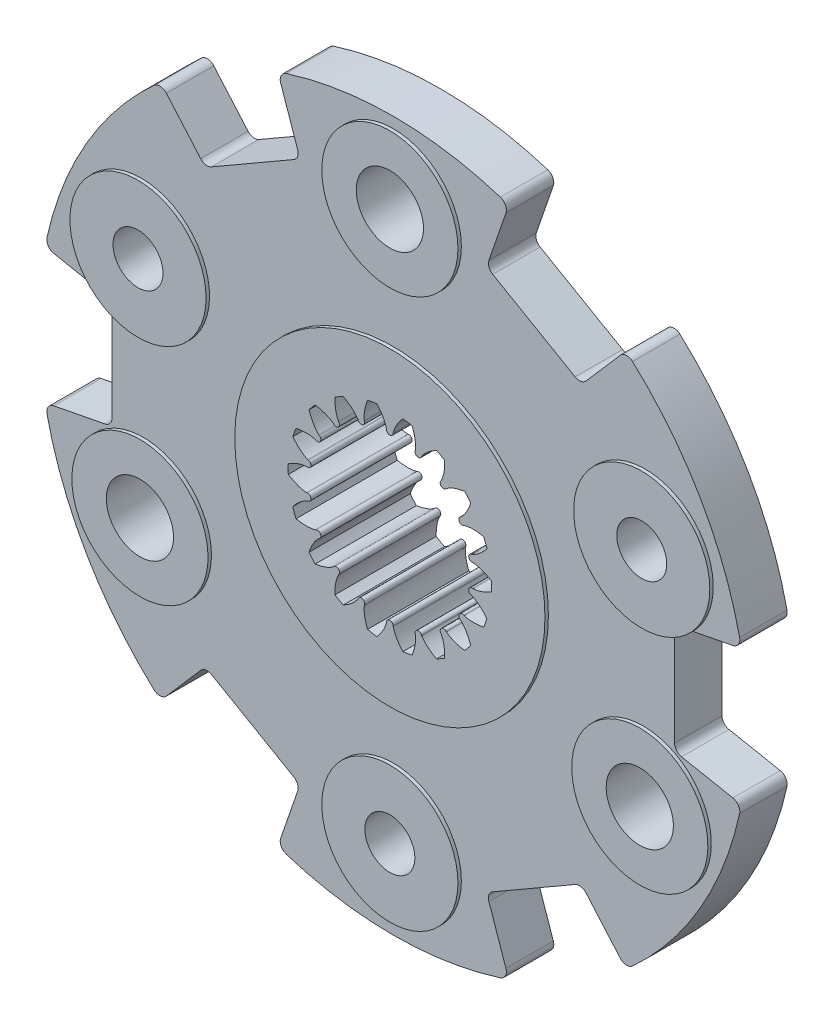
from build123d import *

# Parameters (mm, degrees)
SKETCH1_R                                 = 10.4521
BASE_DISK_DEPTH                           = 1.397
SKETCH2_R                                 = 2.0066
PLATFORM_1_DEPTH                          = 0.1016
SKETCH3_R                                 = 0.9906
HOLE_1_DEPTH                              = 15.857274002
SKETCH7_R                                 = 2.0066
PLATFORM_2_DEPTH                          = 0.1016
SKETCH8_R                                 = 0.7366
HOLE_2_DEPTH                              = 15.857274002
NEGATIVE_PATTERN_OF_PLATFORM_HOLE_1_COUNT = 2
NEGATIVE_PATTERN_OF_PLATFORM_HOLE_1_ANGLE = 115
POSITIVE_PATTERN_OF_PLATFORM_HOLE_1_COUNT = 2
POSITIVE_PATTERN_OF_PLATFORM_HOLE_1_ANGLE = 115
NEGATIVE_PATTERN_OF_PLATFORM_HOLE_2_COUNT = 2
NEGATIVE_PATTERN_OF_PLATFORM_HOLE_2_ANGLE = 113
POSITIVE_PATTERN_OF_PLATFORM_HOLE_2_COUNT = 2
POSITIVE_PATTERN_OF_PLATFORM_HOLE_2_ANGLE = 113
RECTANGULAR_CUT_OUT_DEPTH                 = 15.847370064
PATTERN_FOR_RECTANGULAR_CUT_OUT_COUNT     = 6
EDGE_FILLETS_R                            = 0.254
HUB_DEPTH                                 = 1.4859
HUB_DEPTH_BACK                            = 1.4986
SKETCH5_R                                 = 4.572
HUB_CHAMFER_SIZE                          = 0.381
SPLINE_START                              = -1.4859
SPLINE_CUT_OUT_DEPTH                      = 2.9845
TOLERANCE_CUT_OUT_DEPTH                   = 15.915170021


# Read off the part's stored shape, not the designer's step: Spline cut-out
with BuildPart() as part:
    # Sketch1 → Base disk (new body)
    with BuildSketch(Plane.XY):
        Circle(SKETCH1_R)
    extrude(amount=BASE_DISK_DEPTH)

    # Sketch2 → Platform 1 (add)
    with BuildSketch(Plane.XY.offset(1.397)):
        with Locations((0, 8.128)):
            Circle(SKETCH2_R)
    platform_1 = extrude(amount=PLATFORM_1_DEPTH)

    # Sketch3 → Hole 1 (cut, through all)
    with BuildSketch(Plane.XY.offset(1.4986)):
        with Locations((0, 8.128)):
            Circle(SKETCH3_R)
    hole_1 = extrude(amount=-HOLE_1_DEPTH, mode=Mode.SUBTRACT)

    # Sketch7 → Platform 2 (add)
    with BuildSketch(Plane.XY.offset(1.397)):
        with Locations((0, -8.0645)):
            Circle(SKETCH7_R)
    platform_2 = extrude(amount=PLATFORM_2_DEPTH)

    # Sketch8 → Hole 2 (cut, through all)
    with BuildSketch(Plane.XY.offset(1.4986)):
        with Locations((0, -8.0645)):
            Circle(SKETCH8_R)
    hole_2 = extrude(amount=-HOLE_2_DEPTH, mode=Mode.SUBTRACT)

    # Negative pattern of platform/hole 1: Platform 1, Hole 1 ×2 about axis
    negative_pattern_of_platform_hole_1_axis = Axis((0, 0, 1.397), (0, 0, 1))
    add([platform_1.rotate(negative_pattern_of_platform_hole_1_axis, i * NEGATIVE_PATTERN_OF_PLATFORM_HOLE_1_ANGLE / (NEGATIVE_PATTERN_OF_PLATFORM_HOLE_1_COUNT - 1)) for i in range(1, NEGATIVE_PATTERN_OF_PLATFORM_HOLE_1_COUNT)])
    add([hole_1.rotate(negative_pattern_of_platform_hole_1_axis, i * NEGATIVE_PATTERN_OF_PLATFORM_HOLE_1_ANGLE / (NEGATIVE_PATTERN_OF_PLATFORM_HOLE_1_COUNT - 1)) for i in range(1, NEGATIVE_PATTERN_OF_PLATFORM_HOLE_1_COUNT)], mode=Mode.SUBTRACT)

    # Positive pattern of platform/hole 1: Platform 1, Hole 1 ×2 about axis
    positive_pattern_of_platform_hole_1_axis = Axis((0, 0, 1.397), (0, 0, -1))
    add([platform_1.rotate(positive_pattern_of_platform_hole_1_axis, i * POSITIVE_PATTERN_OF_PLATFORM_HOLE_1_ANGLE / (POSITIVE_PATTERN_OF_PLATFORM_HOLE_1_COUNT - 1)) for i in range(1, POSITIVE_PATTERN_OF_PLATFORM_HOLE_1_COUNT)])
    add([hole_1.rotate(positive_pattern_of_platform_hole_1_axis, i * POSITIVE_PATTERN_OF_PLATFORM_HOLE_1_ANGLE / (POSITIVE_PATTERN_OF_PLATFORM_HOLE_1_COUNT - 1)) for i in range(1, POSITIVE_PATTERN_OF_PLATFORM_HOLE_1_COUNT)], mode=Mode.SUBTRACT)

    # Negative pattern of platform/hole 2: Platform 2, Hole 2 ×2 about axis
    negative_pattern_of_platform_hole_2_axis = Axis((0, 0, 1.397), (0, 0, 1))
    add([platform_2.rotate(negative_pattern_of_platform_hole_2_axis, i * NEGATIVE_PATTERN_OF_PLATFORM_HOLE_2_ANGLE / (NEGATIVE_PATTERN_OF_PLATFORM_HOLE_2_COUNT - 1)) for i in range(1, NEGATIVE_PATTERN_OF_PLATFORM_HOLE_2_COUNT)])
    add([hole_2.rotate(negative_pattern_of_platform_hole_2_axis, i * NEGATIVE_PATTERN_OF_PLATFORM_HOLE_2_ANGLE / (NEGATIVE_PATTERN_OF_PLATFORM_HOLE_2_COUNT - 1)) for i in range(1, NEGATIVE_PATTERN_OF_PLATFORM_HOLE_2_COUNT)], mode=Mode.SUBTRACT)

    # Positive pattern of platform/hole 2: Platform 2, Hole 2 ×2 about axis
    positive_pattern_of_platform_hole_2_axis = Axis((0, 0, 1.397), (0, 0, -1))
    add([platform_2.rotate(positive_pattern_of_platform_hole_2_axis, i * POSITIVE_PATTERN_OF_PLATFORM_HOLE_2_ANGLE / (POSITIVE_PATTERN_OF_PLATFORM_HOLE_2_COUNT - 1)) for i in range(1, POSITIVE_PATTERN_OF_PLATFORM_HOLE_2_COUNT)])
    add([hole_2.rotate(positive_pattern_of_platform_hole_2_axis, i * POSITIVE_PATTERN_OF_PLATFORM_HOLE_2_ANGLE / (POSITIVE_PATTERN_OF_PLATFORM_HOLE_2_COUNT - 1)) for i in range(1, POSITIVE_PATTERN_OF_PLATFORM_HOLE_2_COUNT)], mode=Mode.SUBTRACT)

    # Sketch4 → Rectangular cut-out (cut, through all)
    with BuildSketch(Plane.XY.offset(1.397)):
        with BuildLine():
            Line((-5.540746529, 6.37389976), (-6.857194577, 7.888300003))
            ThreePointArc((-6.857194577, 7.888300003), (-5.22605, 9.051784123), (-3.402870907, 9.882654704))
            Line((-3.402870907, 9.882654704), (-2.749585848, 7.98537713))
            Line((-2.749585848, 7.98537713), (-5.540746529, 6.37389976))
        make_face()
    rectangular_cut_out = extrude(amount=-RECTANGULAR_CUT_OUT_DEPTH, mode=Mode.SUBTRACT)

    # Pattern for rectangular cut-out: Rectangular cut-out ×6 about axis
    pattern_for_rectangular_cut_out_axis = Axis((0, 0, 0), (0, 0, 1))
    for i in range(1, PATTERN_FOR_RECTANGULAR_CUT_OUT_COUNT):
        add(rectangular_cut_out.rotate(pattern_for_rectangular_cut_out_axis, i * 360 / PATTERN_FOR_RECTANGULAR_CUT_OUT_COUNT), mode=Mode.SUBTRACT)

    # Edge fillets
    edge_fillets_edges = [part.edges().sort_by_distance(p)[0] for p in [
        (6.857194577, -7.888300003, 0.6985),
        (3.402870907, -9.882654704, 0.6985),
        (2.749585848, -7.98537713, 0.6985),
        (5.540746529, -6.37389976, 0.6985),
        (10.260065484, 1.994354701, 0.6985),
        (10.260065484, -1.994354701, 0.6985),
        (8.290332378, -1.61147737, 0.6985),
        (8.290332378, 1.61147737, 0.6985),
        (3.402870907, 9.882654704, 0.6985),
        (6.857194577, 7.888300003, 0.6985),
        (5.540746529, 6.37389976, 0.6985),
        (2.749585848, 7.98537713, 0.6985),
        (-6.857194577, 7.888300003, 0.6985),
        (-3.402870907, 9.882654704, 0.6985),
        (-2.749585848, 7.98537713, 0.6985),
        (-5.540746529, 6.37389976, 0.6985),
        (-10.260065484, -1.994354701, 0.6985),
        (-10.260065484, 1.994354701, 0.6985),
        (-8.290332378, 1.61147737, 0.6985),
        (-8.290332378, -1.61147737, 0.6985),
        (-3.402870907, -9.882654704, 0.6985),
        (-6.857194577, -7.888300003, 0.6985),
        (-5.540746529, -6.37389976, 0.6985),
        (-2.749585848, -7.98537713, 0.6985),
    ]]
    fillet(edge_fillets_edges, radius=EDGE_FILLETS_R)

    # Sketch5 → Hub (add, two sides: drawn at the far end of the back side and taken through both)
    with BuildSketch(Plane(origin=(0, 0, 0), x_dir=(-1, 0, 0), z_dir=(0, 0, -1)).offset(-HUB_DEPTH_BACK)):
        Circle(SKETCH5_R)
    extrude(amount=HUB_DEPTH + HUB_DEPTH_BACK)

    # Hub chamfer
    hub_chamfer_edges = [part.edges().sort_by_distance(p)[0] for p in [
        (4.572, 0, -1.4859),
    ]]
    chamfer(hub_chamfer_edges, length=HUB_CHAMFER_SIZE)

    # Spline cut-out outline → Spline cut-out (cut)
    with BuildSketch(Plane.XY.offset(SPLINE_START)):
        with BuildLine():
            Line((-2.441544292, 0.253382626), (-2.457161288, 0.255003353))
            add(Edge.make_bspline(
                [(-2.457161288, 0.255003353), (-2.511970923, 0.25245669), (-2.674677864, 0.22493294), (-2.825486334, 0.152013752), (-2.91943351, 0.095650308)],
                knots=[0, 0, 0, 0, 0.332628043, 1, 1, 1, 1], degree=3))
            ThreePointArc((-2.91943351, 0.095650308), (-2.921, 0), (-2.91943351, -0.095650308))
            add(Edge.make_bspline(
                [(-2.457161288, -0.255003353), (-2.511970923, -0.25245669), (-2.674677864, -0.22493294), (-2.825486334, -0.152013752), (-2.91943351, -0.095650308)],
                knots=[0, 0, 0, 0, 0.332628043, 1, 1, 1, 1], degree=3))
            Line((-2.457161288, -0.255003353), (-2.441544292, -0.253382626))
            ThreePointArc((-2.441544292, -0.253382626), (-2.251270523, -0.396959734), (-2.380963117, -0.596955545))
            Line((-2.380963117, -0.596955545), (-2.396192614, -0.600773887))
            add(Edge.make_bspline(
                [(-2.396192614, -0.600773887), (-2.446825813, -0.621912967), (-2.590306648, -0.703425883), (-2.707080423, -0.82352704), (-2.776084458, -0.908623179)],
                knots=[0, 0, 0, 0, 0.332628043, 1, 1, 1, 1], degree=3))
            ThreePointArc((-2.776084458, -0.908623179), (-2.744842145, -0.999040839), (-2.710655794, -1.088386956))
            add(Edge.make_bspline(
                [(-2.221760047, -1.080023425), (-2.274135267, -1.096376344), (-2.436443455, -1.12616153), (-2.603096893, -1.109219442), (-2.710655794, -1.088386956)],
                knots=[0, 0, 0, 0, 0.332628043, 1, 1, 1, 1], degree=3))
            Line((-2.221760047, -1.080023425), (-2.207639193, -1.073159113))
            ThreePointArc((-2.207639193, -1.073159113), (-1.979734073, -1.143), (-2.03320265, -1.375292067))
            Line((-2.03320265, -1.375292067), (-2.046207746, -1.38408893))
            add(Edge.make_bspline(
                [(-2.046207746, -1.38408893), (-2.086557399, -1.421270741), (-2.193506221, -1.546941162), (-2.262160662, -1.699738317), (-2.29789865, -1.803303301)],
                knots=[0, 0, 0, 0, 0.332628043, 1, 1, 1, 1], degree=3))
            ThreePointArc((-2.29789865, -1.803303301), (-2.237615818, -1.877582608), (-2.174932985, -1.949848074))
            add(Edge.make_bspline(
                [(-1.718381755, -1.774776732), (-1.762005335, -1.80805683), (-1.904338008, -1.891558419), (-2.066735549, -1.932636897), (-2.174932985, -1.949848074)],
                knots=[0, 0, 0, 0, 0.332628043, 1, 1, 1, 1], degree=3))
            Line((-1.718381755, -1.774776732), (-1.707460225, -1.763496773))
            ThreePointArc((-1.707460225, -1.763496773), (-1.469412476, -1.751177597), (-1.440207937, -1.987748068))
            Line((-1.440207937, -1.987748068), (-1.449420026, -2.00046242))
            add(Edge.make_bspline(
                [(-1.449420026, -2.00046242), (-1.474619368, -2.049202288), (-1.532136572, -2.203872507), (-1.544390938, -2.370936067), (-1.542552351, -2.48047843)],
                knots=[0, 0, 0, 0, 0.332628043, 1, 1, 1, 1], degree=3))
            ThreePointArc((-1.542552351, -2.48047843), (-1.4605, -2.529660204), (-1.376881159, -2.576128738))
            add(Edge.make_bspline(
                [(-1.007741262, -2.255465773), (-1.037351555, -2.301658978), (-1.142541292, -2.428805447), (-1.281095396, -2.522949819), (-1.376881159, -2.576128738)],
                knots=[0, 0, 0, 0, 0.332628043, 1, 1, 1, 1], degree=3))
            Line((-1.007741262, -2.255465773), (-1.001336355, -2.241130695))
            ThreePointArc((-1.001336355, -2.241130695), (-0.781858048, -2.148137331), (-0.673502892, -2.360452317))
            Line((-0.673502892, -2.360452317), (-0.677810859, -2.375550619))
            add(Edge.make_bspline(
                [(-0.677810859, -2.375550619), (-0.684820479, -2.429969796), (-0.68596864, -2.594984302), (-0.640344874, -2.756163937), (-0.601151473, -2.858471253)],
                knots=[0, 0, 0, 0, 0.332628043, 1, 1, 1, 1], degree=3))
            ThreePointArc((-0.601151473, -2.858471253), (-0.507226327, -2.876623447), (-0.412757144, -2.891690257))
            add(Edge.make_bspline(
                [(-0.175552301, -2.464112355), (-0.187577868, -2.517647084), (-0.242937234, -2.673102692), (-0.340936231, -2.808957759), (-0.412757144, -2.891690257)],
                knots=[0, 0, 0, 0, 0.332628043, 1, 1, 1, 1], degree=3))
            Line((-0.175552301, -2.464112355), (-0.174436542, -2.44845118))
            ThreePointArc((-0.174436542, -2.44845118), (0, -2.286), (0.174436542, -2.44845118))
            Line((0.174436542, -2.44845118), (0.175552301, -2.464112355))
            add(Edge.make_bspline(
                [(0.175552301, -2.464112355), (0.187577868, -2.517647084), (0.242937234, -2.673102692), (0.340936231, -2.808957759), (0.412757144, -2.891690257)],
                knots=[0, 0, 0, 0, 0.332628043, 1, 1, 1, 1], degree=3))
            ThreePointArc((0.412757144, -2.891690257), (0.507226327, -2.876623447), (0.601151473, -2.858471253))
            add(Edge.make_bspline(
                [(0.677810859, -2.375550619), (0.684820479, -2.429969796), (0.68596864, -2.594984302), (0.640344874, -2.756163937), (0.601151473, -2.858471253)],
                knots=[0, 0, 0, 0, 0.332628043, 1, 1, 1, 1], degree=3))
            Line((0.677810859, -2.375550619), (0.673502892, -2.360452317))
            ThreePointArc((0.673502892, -2.360452317), (0.781858048, -2.148137331), (1.001336355, -2.241130695))
            Line((1.001336355, -2.241130695), (1.007741262, -2.255465773))
            add(Edge.make_bspline(
                [(1.007741262, -2.255465773), (1.037351555, -2.301658978), (1.142541292, -2.428805447), (1.281095396, -2.522949819), (1.376881159, -2.576128738)],
                knots=[0, 0, 0, 0, 0.332628043, 1, 1, 1, 1], degree=3))
            ThreePointArc((1.376881159, -2.576128738), (1.4605, -2.529660204), (1.542552351, -2.48047843))
            add(Edge.make_bspline(
                [(1.449420026, -2.00046242), (1.474619368, -2.049202288), (1.532136572, -2.203872507), (1.544390938, -2.370936067), (1.542552351, -2.48047843)],
                knots=[0, 0, 0, 0, 0.332628043, 1, 1, 1, 1], degree=3))
            Line((1.449420026, -2.00046242), (1.440207937, -1.987748068))
            ThreePointArc((1.440207937, -1.987748068), (1.469412476, -1.751177597), (1.707460225, -1.763496773))
            Line((1.707460225, -1.763496773), (1.718381755, -1.774776732))
            add(Edge.make_bspline(
                [(1.718381755, -1.774776732), (1.762005335, -1.80805683), (1.904338008, -1.891558419), (2.066735549, -1.932636897), (2.174932985, -1.949848074)],
                knots=[0, 0, 0, 0, 0.332628043, 1, 1, 1, 1], degree=3))
            ThreePointArc((2.174932985, -1.949848074), (2.237615818, -1.877582608), (2.29789865, -1.803303301))
            add(Edge.make_bspline(
                [(2.046207746, -1.38408893), (2.086557399, -1.421270741), (2.193506221, -1.546941162), (2.262160662, -1.699738317), (2.29789865, -1.803303301)],
                knots=[0, 0, 0, 0, 0.332628043, 1, 1, 1, 1], degree=3))
            Line((2.046207746, -1.38408893), (2.03320265, -1.375292067))
            ThreePointArc((2.03320265, -1.375292067), (1.979734073, -1.143), (2.207639193, -1.073159113))
            Line((2.207639193, -1.073159113), (2.221760047, -1.080023425))
            add(Edge.make_bspline(
                [(2.221760047, -1.080023425), (2.274135267, -1.096376344), (2.436443455, -1.12616153), (2.603096893, -1.109219442), (2.710655794, -1.088386956)],
                knots=[0, 0, 0, 0, 0.332628043, 1, 1, 1, 1], degree=3))
            ThreePointArc((2.710655794, -1.088386956), (2.744842145, -0.999040839), (2.776084458, -0.908623179))
            add(Edge.make_bspline(
                [(2.396192614, -0.600773887), (2.446825813, -0.621912967), (2.590306648, -0.703425883), (2.707080423, -0.82352704), (2.776084458, -0.908623179)],
                knots=[0, 0, 0, 0, 0.332628043, 1, 1, 1, 1], degree=3))
            Line((2.396192614, -0.600773887), (2.380963117, -0.596955545))
            ThreePointArc((2.380963117, -0.596955545), (2.251270523, -0.396959734), (2.441544292, -0.253382626))
            Line((2.441544292, -0.253382626), (2.457161288, -0.255003353))
            add(Edge.make_bspline(
                [(2.457161288, -0.255003353), (2.511970923, -0.25245669), (2.674677864, -0.22493294), (2.825486334, -0.152013752), (2.91943351, -0.095650308)],
                knots=[0, 0, 0, 0, 0.332628043, 1, 1, 1, 1], degree=3))
            ThreePointArc((2.91943351, -0.095650308), (2.921, 0), (2.91943351, 0.095650308))
            add(Edge.make_bspline(
                [(2.457161288, 0.255003353), (2.511970923, 0.25245669), (2.674677864, 0.22493294), (2.825486334, 0.152013752), (2.91943351, 0.095650308)],
                knots=[0, 0, 0, 0, 0.332628043, 1, 1, 1, 1], degree=3))
            Line((2.457161288, 0.255003353), (2.441544292, 0.253382626))
            ThreePointArc((2.441544292, 0.253382626), (2.251270523, 0.396959734), (2.380963117, 0.596955545))
            Line((2.380963117, 0.596955545), (2.396192614, 0.600773887))
            add(Edge.make_bspline(
                [(2.396192614, 0.600773887), (2.446825813, 0.621912967), (2.590306648, 0.703425883), (2.707080423, 0.82352704), (2.776084458, 0.908623179)],
                knots=[0, 0, 0, 0, 0.332628043, 1, 1, 1, 1], degree=3))
            ThreePointArc((2.776084458, 0.908623179), (2.744842145, 0.999040839), (2.710655794, 1.088386956))
            add(Edge.make_bspline(
                [(2.221760047, 1.080023425), (2.274135267, 1.096376344), (2.436443455, 1.12616153), (2.603096893, 1.109219442), (2.710655794, 1.088386956)],
                knots=[0, 0, 0, 0, 0.332628043, 1, 1, 1, 1], degree=3))
            Line((2.221760047, 1.080023425), (2.207639193, 1.073159113))
            ThreePointArc((2.207639193, 1.073159113), (1.979734073, 1.143), (2.03320265, 1.375292067))
            Line((2.03320265, 1.375292067), (2.046207746, 1.38408893))
            add(Edge.make_bspline(
                [(2.046207746, 1.38408893), (2.086557399, 1.421270741), (2.193506221, 1.546941162), (2.262160662, 1.699738317), (2.29789865, 1.803303301)],
                knots=[0, 0, 0, 0, 0.332628043, 1, 1, 1, 1], degree=3))
            ThreePointArc((2.29789865, 1.803303301), (2.237615818, 1.877582608), (2.174932985, 1.949848074))
            add(Edge.make_bspline(
                [(1.718381755, 1.774776732), (1.762005335, 1.80805683), (1.904338008, 1.891558419), (2.066735549, 1.932636897), (2.174932985, 1.949848074)],
                knots=[0, 0, 0, 0, 0.332628043, 1, 1, 1, 1], degree=3))
            Line((1.718381755, 1.774776732), (1.707460225, 1.763496773))
            ThreePointArc((1.707460225, 1.763496773), (1.469412476, 1.751177597), (1.440207937, 1.987748068))
            Line((1.440207937, 1.987748068), (1.449420026, 2.00046242))
            add(Edge.make_bspline(
                [(1.449420026, 2.00046242), (1.474619368, 2.049202288), (1.532136572, 2.203872507), (1.544390938, 2.370936067), (1.542552351, 2.48047843)],
                knots=[0, 0, 0, 0, 0.332628043, 1, 1, 1, 1], degree=3))
            ThreePointArc((1.542552351, 2.48047843), (1.4605, 2.529660204), (1.376881159, 2.576128738))
            add(Edge.make_bspline(
                [(1.007741262, 2.255465773), (1.037351555, 2.301658978), (1.142541292, 2.428805447), (1.281095396, 2.522949819), (1.376881159, 2.576128738)],
                knots=[0, 0, 0, 0, 0.332628043, 1, 1, 1, 1], degree=3))
            Line((1.007741262, 2.255465773), (1.001336355, 2.241130695))
            ThreePointArc((1.001336355, 2.241130695), (0.781858048, 2.148137331), (0.673502892, 2.360452317))
            Line((0.673502892, 2.360452317), (0.677810859, 2.375550619))
            add(Edge.make_bspline(
                [(0.677810859, 2.375550619), (0.684820479, 2.429969796), (0.68596864, 2.594984302), (0.640344874, 2.756163937), (0.601151473, 2.858471253)],
                knots=[0, 0, 0, 0, 0.332628043, 1, 1, 1, 1], degree=3))
            ThreePointArc((0.601151473, 2.858471253), (0.507226327, 2.876623447), (0.412757144, 2.891690257))
            add(Edge.make_bspline(
                [(0.175552301, 2.464112355), (0.187577868, 2.517647084), (0.242937234, 2.673102692), (0.340936231, 2.808957759), (0.412757144, 2.891690257)],
                knots=[0, 0, 0, 0, 0.332628043, 1, 1, 1, 1], degree=3))
            Line((0.175552301, 2.464112355), (0.174436542, 2.44845118))
            ThreePointArc((0.174436542, 2.44845118), (0, 2.286), (-0.174436542, 2.44845118))
            Line((-0.174436542, 2.44845118), (-0.175552301, 2.464112355))
            add(Edge.make_bspline(
                [(-0.175552301, 2.464112355), (-0.187577868, 2.517647084), (-0.242937234, 2.673102692), (-0.340936231, 2.808957759), (-0.412757144, 2.891690257)],
                knots=[0, 0, 0, 0, 0.332628043, 1, 1, 1, 1], degree=3))
            ThreePointArc((-0.412757144, 2.891690257), (-0.507226327, 2.876623447), (-0.601151473, 2.858471253))
            add(Edge.make_bspline(
                [(-0.677810859, 2.375550619), (-0.684820479, 2.429969796), (-0.68596864, 2.594984302), (-0.640344874, 2.756163937), (-0.601151473, 2.858471253)],
                knots=[0, 0, 0, 0, 0.332628043, 1, 1, 1, 1], degree=3))
            Line((-0.677810859, 2.375550619), (-0.673502892, 2.360452317))
            ThreePointArc((-0.673502892, 2.360452317), (-0.781858048, 2.148137331), (-1.001336355, 2.241130695))
            Line((-1.001336355, 2.241130695), (-1.007741262, 2.255465773))
            add(Edge.make_bspline(
                [(-1.007741262, 2.255465773), (-1.037351555, 2.301658978), (-1.142541292, 2.428805447), (-1.281095396, 2.522949819), (-1.376881159, 2.576128738)],
                knots=[0, 0, 0, 0, 0.332628043, 1, 1, 1, 1], degree=3))
            ThreePointArc((-1.376881159, 2.576128738), (-1.4605, 2.529660204), (-1.542552351, 2.48047843))
            add(Edge.make_bspline(
                [(-1.449420026, 2.00046242), (-1.474619368, 2.049202288), (-1.532136572, 2.203872507), (-1.544390938, 2.370936067), (-1.542552351, 2.48047843)],
                knots=[0, 0, 0, 0, 0.332628043, 1, 1, 1, 1], degree=3))
            Line((-1.449420026, 2.00046242), (-1.440207937, 1.987748068))
            ThreePointArc((-1.440207937, 1.987748068), (-1.469412476, 1.751177597), (-1.707460225, 1.763496773))
            Line((-1.707460225, 1.763496773), (-1.718381755, 1.774776732))
            add(Edge.make_bspline(
                [(-1.718381755, 1.774776732), (-1.762005335, 1.80805683), (-1.904338008, 1.891558419), (-2.066735549, 1.932636897), (-2.174932985, 1.949848074)],
                knots=[0, 0, 0, 0, 0.332628043, 1, 1, 1, 1], degree=3))
            ThreePointArc((-2.174932985, 1.949848074), (-2.237615818, 1.877582608), (-2.29789865, 1.803303301))
            add(Edge.make_bspline(
                [(-2.046207746, 1.38408893), (-2.086557399, 1.421270741), (-2.193506221, 1.546941162), (-2.262160662, 1.699738317), (-2.29789865, 1.803303301)],
                knots=[0, 0, 0, 0, 0.332628043, 1, 1, 1, 1], degree=3))
            Line((-2.046207746, 1.38408893), (-2.03320265, 1.375292067))
            ThreePointArc((-2.03320265, 1.375292067), (-1.979734073, 1.143), (-2.207639193, 1.073159113))
            Line((-2.207639193, 1.073159113), (-2.221760047, 1.080023425))
            add(Edge.make_bspline(
                [(-2.221760047, 1.080023425), (-2.274135267, 1.096376344), (-2.436443455, 1.12616153), (-2.603096893, 1.109219442), (-2.710655794, 1.088386956)],
                knots=[0, 0, 0, 0, 0.332628043, 1, 1, 1, 1], degree=3))
            ThreePointArc((-2.710655794, 1.088386956), (-2.744842145, 0.999040839), (-2.776084458, 0.908623179))
            add(Edge.make_bspline(
                [(-2.396192614, 0.600773887), (-2.446825813, 0.621912967), (-2.590306648, 0.703425883), (-2.707080423, 0.82352704), (-2.776084458, 0.908623179)],
                knots=[0, 0, 0, 0, 0.332628043, 1, 1, 1, 1], degree=3))
            Line((-2.396192614, 0.600773887), (-2.380963117, 0.596955545))
            ThreePointArc((-2.380963117, 0.596955545), (-2.251270523, 0.396959734), (-2.441544292, 0.253382626))
        make_face()
    extrude(amount=SPLINE_CUT_OUT_DEPTH, mode=Mode.SUBTRACT)

    # Sketch6 → Tolerance cut-out (cut, through all)
    with BuildSketch(Plane.XY.offset(1.4986)):
        with BuildLine():
            Line((2.420271814, -0.528252538), (2.399494428, -0.523043228))
            ThreePointArc((2.399494428, -0.523043228), (2.326312874, -0.410191725), (2.433678527, -0.329175566))
            Line((2.433678527, -0.329175566), (2.454984573, -0.3313867))
            add(Edge.make_bspline(
                [(2.454984573, -0.3313867), (2.645441737, -0.32253734), (2.830441607, -0.237902523), (2.993937206, -0.139813624)],
                knots=[-0.011557885, -0.011557885, -0.011557885, -0.011557885, 1.083590596, 1.083590596, 1.083590596, 1.083590596], degree=3))
            ThreePointArc((2.993937206, -0.139813624), (2.9972, 0), (2.993937206, 0.139813624))
            add(Edge.make_bspline(
                [(2.993937206, 0.139813624), (2.830441607, 0.237902523), (2.645441737, 0.32253734), (2.454984573, 0.3313867)],
                knots=[-0.083590596, -0.083590596, -0.083590596, -0.083590596, 1.011557885, 1.011557885, 1.011557885, 1.011557885], degree=3))
            Line((2.454984573, 0.3313867), (2.433678527, 0.329175566))
            ThreePointArc((2.433678527, 0.329175566), (2.326312874, 0.410191725), (2.399494428, 0.523043228))
            Line((2.399494428, 0.523043228), (2.420271814, 0.528252538))
            add(Edge.make_bspline(
                [(2.420271814, 0.528252538), (2.596216347, 0.601708404), (2.741112547, 0.744512799), (2.861199775, 0.892605002)],
                knots=[-0.011557885, -0.011557885, -0.011557885, -0.011557885, 1.083590596, 1.083590596, 1.083590596, 1.083590596], degree=3))
            ThreePointArc((2.861199775, 0.892605002), (2.816446723, 1.025102774), (2.765561623, 1.155368663))
            add(Edge.make_bspline(
                [(2.765561623, 1.155368663), (2.578377637, 1.191623289), (2.375587812, 1.207880321), (2.19358996, 1.151055812)],
                knots=[-0.083590596, -0.083590596, -0.083590596, -0.083590596, 1.011557885, 1.011557885, 1.011557885, 1.011557885], degree=3))
            Line((2.19358996, 1.151055812), (2.174325079, 1.141690929))
            ThreePointArc((2.174325079, 1.141690929), (2.045725209, 1.1811), (2.075895887, 1.31217529))
            Line((2.075895887, 1.31217529), (2.093638555, 1.324176725))
            add(Edge.make_bspline(
                [(2.093638555, 1.324176725), (2.233848948, 1.453379234), (2.321164859, 1.63712889), (2.383359424, 1.81736229)],
                knots=[-0.011557885, -0.011557885, -0.011557885, -0.011557885, 1.083590596, 1.083590596, 1.083590596, 1.083590596], degree=3))
            ThreePointArc((2.383359424, 1.81736229), (2.295988405, 1.926563024), (2.203618494, 2.03156919))
            add(Edge.make_bspline(
                [(2.203618494, 2.03156919), (2.015323271, 2.001616701), (1.819202936, 1.947535108), (1.667616025, 1.831890606)],
                knots=[-0.083590596, -0.083590596, -0.083590596, -0.083590596, 1.011557885, 1.011557885, 1.011557885, 1.011557885], degree=3))
            Line((1.667616025, 1.831890606), (1.652715937, 1.816501517))
            ThreePointArc((1.652715937, 1.816501517), (1.518392892, 1.809550184), (1.501913666, 1.943039646))
            Line((1.501913666, 1.943039646), (1.514481587, 1.960385656))
            add(Edge.make_bspline(
                [(1.514481587, 1.960385656), (1.602046399, 2.129751079), (1.621250432, 2.332283075), (1.618050753, 2.522918865)],
                knots=[-0.011557885, -0.011557885, -0.011557885, -0.011557885, 1.083590596, 1.083590596, 1.083590596, 1.083590596], degree=3))
            ThreePointArc((1.618050753, 2.522918865), (1.4986, 2.59565134), (1.375886453, 2.662732489))
            add(Edge.make_bspline(
                [(1.375886453, 2.662732489), (1.209191175, 2.570185597), (1.043395338, 2.452288419), (0.940502985, 2.291772356)],
                knots=[-0.083590596, -0.083590596, -0.083590596, -0.083590596, 1.011557885, 1.011557885, 1.011557885, 1.011557885], degree=3))
            Line((0.940502985, 2.291772356), (0.931764861, 2.272215212))
            ThreePointArc((0.931764861, 2.272215212), (0.807919983, 2.219741909), (0.746778491, 2.339544745))
            Line((0.746778491, 2.339544745), (0.752655789, 2.360143144))
            add(Edge.make_bspline(
                [(0.752655789, 2.360143144), (0.77701341, 2.549243512), (0.725789276, 2.7461295), (0.657581281, 2.924174191)],
                knots=[-0.011557885, -0.011557885, -0.011557885, -0.011557885, 1.083590596, 1.083590596, 1.083590596, 1.083590596], degree=3))
            ThreePointArc((0.657581281, 2.924174191), (0.520458318, 2.951665797), (0.382202199, 2.972730953))
            add(Edge.make_bspline(
                [(0.382202199, 2.972730953), (0.257212778, 2.828752179), (0.141738864, 2.661259554), (0.099951405, 2.475232537)],
                knots=[-0.083590596, -0.083590596, -0.083590596, -0.083590596, 1.011557885, 1.011557885, 1.011557885, 1.011557885], degree=3))
            Line((0.099951405, 2.475232537), (0.098429191, 2.453866219))
            ThreePointArc((0.098429191, 2.453866219), (0, 2.3622), (-0.098429191, 2.453866219))
            Line((-0.098429191, 2.453866219), (-0.099951405, 2.475232537))
            add(Edge.make_bspline(
                [(-0.099951405, 2.475232537), (-0.141738864, 2.661259554), (-0.257212778, 2.828752179), (-0.382202199, 2.972730953)],
                knots=[-0.011557885, -0.011557885, -0.011557885, -0.011557885, 1.083590596, 1.083590596, 1.083590596, 1.083590596], degree=3))
            ThreePointArc((-0.382202199, 2.972730953), (-0.520458318, 2.951665797), (-0.657581281, 2.924174191))
            add(Edge.make_bspline(
                [(-0.657581281, 2.924174191), (-0.725789276, 2.7461295), (-0.77701341, 2.549243512), (-0.752655789, 2.360143144)],
                knots=[-0.083590596, -0.083590596, -0.083590596, -0.083590596, 1.011557885, 1.011557885, 1.011557885, 1.011557885], degree=3))
            Line((-0.752655789, 2.360143144), (-0.746778491, 2.339544745))
            ThreePointArc((-0.746778491, 2.339544745), (-0.807919983, 2.219741909), (-0.931764861, 2.272215212))
            Line((-0.931764861, 2.272215212), (-0.940502985, 2.291772356))
            add(Edge.make_bspline(
                [(-0.940502985, 2.291772356), (-1.043395338, 2.452288419), (-1.209191175, 2.570185597), (-1.375886453, 2.662732489)],
                knots=[-0.011557885, -0.011557885, -0.011557885, -0.011557885, 1.083590596, 1.083590596, 1.083590596, 1.083590596], degree=3))
            ThreePointArc((-1.375886453, 2.662732489), (-1.4986, 2.59565134), (-1.618050753, 2.522918865))
            add(Edge.make_bspline(
                [(-1.618050753, 2.522918865), (-1.621250432, 2.332283075), (-1.602046399, 2.129751079), (-1.514481587, 1.960385656)],
                knots=[-0.083590596, -0.083590596, -0.083590596, -0.083590596, 1.011557885, 1.011557885, 1.011557885, 1.011557885], degree=3))
            Line((-1.514481587, 1.960385656), (-1.501913666, 1.943039646))
            ThreePointArc((-1.501913666, 1.943039646), (-1.518392892, 1.809550184), (-1.652715937, 1.816501517))
            Line((-1.652715937, 1.816501517), (-1.667616025, 1.831890606))
            add(Edge.make_bspline(
                [(-1.667616025, 1.831890606), (-1.819202936, 1.947535108), (-2.015323271, 2.001616701), (-2.203618494, 2.03156919)],
                knots=[-0.011557885, -0.011557885, -0.011557885, -0.011557885, 1.083590596, 1.083590596, 1.083590596, 1.083590596], degree=3))
            ThreePointArc((-2.203618494, 2.03156919), (-2.295988405, 1.926563024), (-2.383359424, 1.81736229))
            add(Edge.make_bspline(
                [(-2.383359424, 1.81736229), (-2.321164859, 1.63712889), (-2.233848948, 1.453379234), (-2.093638555, 1.324176725)],
                knots=[-0.083590596, -0.083590596, -0.083590596, -0.083590596, 1.011557885, 1.011557885, 1.011557885, 1.011557885], degree=3))
            Line((-2.093638555, 1.324176725), (-2.075895887, 1.31217529))
            ThreePointArc((-2.075895887, 1.31217529), (-2.045725209, 1.1811), (-2.174325079, 1.141690929))
            Line((-2.174325079, 1.141690929), (-2.19358996, 1.151055812))
            add(Edge.make_bspline(
                [(-2.19358996, 1.151055812), (-2.375587812, 1.207880321), (-2.578377637, 1.191623289), (-2.765561623, 1.155368663)],
                knots=[-0.011557885, -0.011557885, -0.011557885, -0.011557885, 1.083590596, 1.083590596, 1.083590596, 1.083590596], degree=3))
            ThreePointArc((-2.765561623, 1.155368663), (-2.816446723, 1.025102774), (-2.861199775, 0.892605002))
            add(Edge.make_bspline(
                [(-2.861199775, 0.892605002), (-2.741112547, 0.744512799), (-2.596216347, 0.601708404), (-2.420271814, 0.528252538)],
                knots=[-0.083590596, -0.083590596, -0.083590596, -0.083590596, 1.011557885, 1.011557885, 1.011557885, 1.011557885], degree=3))
            Line((-2.420271814, 0.528252538), (-2.399494428, 0.523043228))
            ThreePointArc((-2.399494428, 0.523043228), (-2.326312874, 0.410191725), (-2.433678527, 0.329175566))
            Line((-2.433678527, 0.329175566), (-2.454984573, 0.3313867))
            add(Edge.make_bspline(
                [(-2.454984573, 0.3313867), (-2.645441737, 0.32253734), (-2.830441607, 0.237902523), (-2.993937206, 0.139813624)],
                knots=[-0.011557885, -0.011557885, -0.011557885, -0.011557885, 1.083590596, 1.083590596, 1.083590596, 1.083590596], degree=3))
            ThreePointArc((-2.993937206, 0.139813624), (-2.9972, 0), (-2.993937206, -0.139813624))
            add(Edge.make_bspline(
                [(-2.993937206, -0.139813624), (-2.830441607, -0.237902523), (-2.645441737, -0.32253734), (-2.454984573, -0.3313867)],
                knots=[-0.083590596, -0.083590596, -0.083590596, -0.083590596, 1.011557885, 1.011557885, 1.011557885, 1.011557885], degree=3))
            Line((-2.454984573, -0.3313867), (-2.433678527, -0.329175566))
            ThreePointArc((-2.433678527, -0.329175566), (-2.326312874, -0.410191725), (-2.399494428, -0.523043228))
            Line((-2.399494428, -0.523043228), (-2.420271814, -0.528252538))
            add(Edge.make_bspline(
                [(-2.420271814, -0.528252538), (-2.596216347, -0.601708404), (-2.741112547, -0.744512799), (-2.861199775, -0.892605002)],
                knots=[-0.011557885, -0.011557885, -0.011557885, -0.011557885, 1.083590596, 1.083590596, 1.083590596, 1.083590596], degree=3))
            ThreePointArc((-2.861199775, -0.892605002), (-2.816446723, -1.025102774), (-2.765561623, -1.155368663))
            add(Edge.make_bspline(
                [(-2.765561623, -1.155368663), (-2.578377637, -1.191623289), (-2.375587812, -1.207880321), (-2.19358996, -1.151055812)],
                knots=[-0.083590596, -0.083590596, -0.083590596, -0.083590596, 1.011557885, 1.011557885, 1.011557885, 1.011557885], degree=3))
            Line((-2.19358996, -1.151055812), (-2.174325079, -1.141690929))
            ThreePointArc((-2.174325079, -1.141690929), (-2.045725209, -1.1811), (-2.075895887, -1.31217529))
            Line((-2.075895887, -1.31217529), (-2.093638555, -1.324176725))
            add(Edge.make_bspline(
                [(-2.093638555, -1.324176725), (-2.233848948, -1.453379234), (-2.321164859, -1.63712889), (-2.383359424, -1.81736229)],
                knots=[-0.011557885, -0.011557885, -0.011557885, -0.011557885, 1.083590596, 1.083590596, 1.083590596, 1.083590596], degree=3))
            ThreePointArc((-2.383359424, -1.81736229), (-2.295988405, -1.926563024), (-2.203618494, -2.03156919))
            add(Edge.make_bspline(
                [(-2.203618494, -2.03156919), (-2.015323271, -2.001616701), (-1.819202936, -1.947535108), (-1.667616025, -1.831890606)],
                knots=[-0.083590596, -0.083590596, -0.083590596, -0.083590596, 1.011557885, 1.011557885, 1.011557885, 1.011557885], degree=3))
            Line((-1.667616025, -1.831890606), (-1.652715937, -1.816501517))
            ThreePointArc((-1.652715937, -1.816501517), (-1.518392892, -1.809550184), (-1.501913666, -1.943039646))
            Line((-1.501913666, -1.943039646), (-1.514481587, -1.960385656))
            add(Edge.make_bspline(
                [(-1.514481587, -1.960385656), (-1.602046399, -2.129751079), (-1.621250432, -2.332283075), (-1.618050753, -2.522918865)],
                knots=[-0.011557885, -0.011557885, -0.011557885, -0.011557885, 1.083590596, 1.083590596, 1.083590596, 1.083590596], degree=3))
            ThreePointArc((-1.618050753, -2.522918865), (-1.4986, -2.59565134), (-1.375886453, -2.662732489))
            add(Edge.make_bspline(
                [(-1.375886453, -2.662732489), (-1.209191175, -2.570185597), (-1.043395338, -2.452288419), (-0.940502985, -2.291772356)],
                knots=[-0.083590596, -0.083590596, -0.083590596, -0.083590596, 1.011557885, 1.011557885, 1.011557885, 1.011557885], degree=3))
            Line((-0.940502985, -2.291772356), (-0.931764861, -2.272215212))
            ThreePointArc((-0.931764861, -2.272215212), (-0.807919983, -2.219741909), (-0.746778491, -2.339544745))
            Line((-0.746778491, -2.339544745), (-0.752655789, -2.360143144))
            add(Edge.make_bspline(
                [(-0.752655789, -2.360143144), (-0.77701341, -2.549243512), (-0.725789276, -2.7461295), (-0.657581281, -2.924174191)],
                knots=[-0.011557885, -0.011557885, -0.011557885, -0.011557885, 1.083590596, 1.083590596, 1.083590596, 1.083590596], degree=3))
            ThreePointArc((-0.657581281, -2.924174191), (-0.520458318, -2.951665797), (-0.382202199, -2.972730953))
            add(Edge.make_bspline(
                [(-0.382202199, -2.972730953), (-0.257212778, -2.828752179), (-0.141738864, -2.661259554), (-0.099951405, -2.475232537)],
                knots=[-0.083590596, -0.083590596, -0.083590596, -0.083590596, 1.011557885, 1.011557885, 1.011557885, 1.011557885], degree=3))
            Line((-0.099951405, -2.475232537), (-0.098429191, -2.453866219))
            ThreePointArc((-0.098429191, -2.453866219), (0, -2.3622), (0.098429191, -2.453866219))
            Line((0.098429191, -2.453866219), (0.099951405, -2.475232537))
            add(Edge.make_bspline(
                [(0.099951405, -2.475232537), (0.141738864, -2.661259554), (0.257212778, -2.828752179), (0.382202199, -2.972730953)],
                knots=[-0.011557885, -0.011557885, -0.011557885, -0.011557885, 1.083590596, 1.083590596, 1.083590596, 1.083590596], degree=3))
            ThreePointArc((0.382202199, -2.972730953), (0.520458318, -2.951665797), (0.657581281, -2.924174191))
            add(Edge.make_bspline(
                [(0.657581281, -2.924174191), (0.725789276, -2.7461295), (0.77701341, -2.549243512), (0.752655789, -2.360143144)],
                knots=[-0.083590596, -0.083590596, -0.083590596, -0.083590596, 1.011557885, 1.011557885, 1.011557885, 1.011557885], degree=3))
            Line((0.752655789, -2.360143144), (0.746778491, -2.339544745))
            ThreePointArc((0.746778491, -2.339544745), (0.807919983, -2.219741909), (0.931764861, -2.272215212))
            Line((0.931764861, -2.272215212), (0.940502985, -2.291772356))
            add(Edge.make_bspline(
                [(0.940502985, -2.291772356), (1.043395338, -2.452288419), (1.209191175, -2.570185597), (1.375886453, -2.662732489)],
                knots=[-0.011557885, -0.011557885, -0.011557885, -0.011557885, 1.083590596, 1.083590596, 1.083590596, 1.083590596], degree=3))
            ThreePointArc((1.375886453, -2.662732489), (1.4986, -2.59565134), (1.618050753, -2.522918865))
            add(Edge.make_bspline(
                [(1.618050753, -2.522918865), (1.621250432, -2.332283075), (1.602046399, -2.129751079), (1.514481587, -1.960385656)],
                knots=[-0.083590596, -0.083590596, -0.083590596, -0.083590596, 1.011557885, 1.011557885, 1.011557885, 1.011557885], degree=3))
            Line((1.514481587, -1.960385656), (1.501913666, -1.943039646))
            ThreePointArc((1.501913666, -1.943039646), (1.518392892, -1.809550184), (1.652715937, -1.816501517))
            Line((1.652715937, -1.816501517), (1.667616025, -1.831890606))
            add(Edge.make_bspline(
                [(1.667616025, -1.831890606), (1.819202936, -1.947535108), (2.015323271, -2.001616701), (2.203618494, -2.03156919)],
                knots=[-0.011557885, -0.011557885, -0.011557885, -0.011557885, 1.083590596, 1.083590596, 1.083590596, 1.083590596], degree=3))
            ThreePointArc((2.203618494, -2.03156919), (2.295988405, -1.926563024), (2.383359424, -1.81736229))
            add(Edge.make_bspline(
                [(2.383359424, -1.81736229), (2.321164859, -1.63712889), (2.233848948, -1.453379234), (2.093638555, -1.324176725)],
                knots=[-0.083590596, -0.083590596, -0.083590596, -0.083590596, 1.011557885, 1.011557885, 1.011557885, 1.011557885], degree=3))
            Line((2.093638555, -1.324176725), (2.075895887, -1.31217529))
            ThreePointArc((2.075895887, -1.31217529), (2.045725209, -1.1811), (2.174325079, -1.141690929))
            Line((2.174325079, -1.141690929), (2.19358996, -1.151055812))
            add(Edge.make_bspline(
                [(2.19358996, -1.151055812), (2.375587812, -1.207880321), (2.578377637, -1.191623289), (2.765561623, -1.155368663)],
                knots=[-0.011557885, -0.011557885, -0.011557885, -0.011557885, 1.083590596, 1.083590596, 1.083590596, 1.083590596], degree=3))
            ThreePointArc((2.765561623, -1.155368663), (2.816446723, -1.025102774), (2.861199775, -0.892605002))
            add(Edge.make_bspline(
                [(2.861199775, -0.892605002), (2.741112547, -0.744512799), (2.596216347, -0.601708404), (2.420271814, -0.528252538)],
                knots=[-0.083590596, -0.083590596, -0.083590596, -0.083590596, 1.011557885, 1.011557885, 1.011557885, 1.011557885], degree=3))
        make_face()
        with BuildLine():
            Line((2.396192614, -0.600773887), (2.380963117, -0.596955545))
            ThreePointArc((2.380963117, -0.596955545), (2.251270523, -0.396959734), (2.441544292, -0.253382626))
            Line((2.441544292, -0.253382626), (2.457161288, -0.255003353))
            add(Edge.make_bspline(
                [(2.457161288, -0.255003353), (2.511970923, -0.25245669), (2.674677864, -0.22493294), (2.825486334, -0.152013752), (2.91943351, -0.095650308)],
                knots=[0, 0, 0, 0, 0.332628043, 1, 1, 1, 1], degree=3))
            ThreePointArc((2.91943351, -0.095650308), (2.921, 0), (2.91943351, 0.095650308))
            add(Edge.make_bspline(
                [(2.91943351, 0.095650308), (2.825486334, 0.152013752), (2.674677864, 0.22493294), (2.511970923, 0.25245669), (2.457161288, 0.255003353)],
                knots=[0, 0, 0, 0, 0.667371957, 1, 1, 1, 1], degree=3))
            Line((2.457161288, 0.255003353), (2.441544292, 0.253382626))
            ThreePointArc((2.441544292, 0.253382626), (2.251270523, 0.396959734), (2.380963117, 0.596955545))
            Line((2.380963117, 0.596955545), (2.396192614, 0.600773887))
            add(Edge.make_bspline(
                [(2.396192614, 0.600773887), (2.446825813, 0.621912967), (2.590306648, 0.703425883), (2.707080423, 0.82352704), (2.776084458, 0.908623179)],
                knots=[0, 0, 0, 0, 0.332628043, 1, 1, 1, 1], degree=3))
            ThreePointArc((2.776084458, 0.908623179), (2.744842145, 0.999040839), (2.710655794, 1.088386956))
            add(Edge.make_bspline(
                [(2.710655794, 1.088386956), (2.603096893, 1.109219442), (2.436443455, 1.12616153), (2.274135267, 1.096376344), (2.221760047, 1.080023425)],
                knots=[0, 0, 0, 0, 0.667371957, 1, 1, 1, 1], degree=3))
            Line((2.221760047, 1.080023425), (2.207639193, 1.073159113))
            ThreePointArc((2.207639193, 1.073159113), (1.979734073, 1.143), (2.03320265, 1.375292067))
            Line((2.03320265, 1.375292067), (2.046207746, 1.38408893))
            add(Edge.make_bspline(
                [(2.046207746, 1.38408893), (2.086557399, 1.421270741), (2.193506221, 1.546941162), (2.262160662, 1.699738317), (2.29789865, 1.803303301)],
                knots=[0, 0, 0, 0, 0.332628043, 1, 1, 1, 1], degree=3))
            ThreePointArc((2.29789865, 1.803303301), (2.237615818, 1.877582608), (2.174932985, 1.949848074))
            add(Edge.make_bspline(
                [(2.174932985, 1.949848074), (2.066735549, 1.932636897), (1.904338008, 1.891558419), (1.762005335, 1.80805683), (1.718381755, 1.774776732)],
                knots=[0, 0, 0, 0, 0.667371957, 1, 1, 1, 1], degree=3))
            Line((1.718381755, 1.774776732), (1.707460225, 1.763496773))
            ThreePointArc((1.707460225, 1.763496773), (1.469412476, 1.751177597), (1.440207937, 1.987748068))
            Line((1.440207937, 1.987748068), (1.449420026, 2.00046242))
            add(Edge.make_bspline(
                [(1.449420026, 2.00046242), (1.474619368, 2.049202288), (1.532136572, 2.203872507), (1.544390938, 2.370936067), (1.542552351, 2.48047843)],
                knots=[0, 0, 0, 0, 0.332628043, 1, 1, 1, 1], degree=3))
            ThreePointArc((1.542552351, 2.48047843), (1.4605, 2.529660204), (1.376881159, 2.576128738))
            add(Edge.make_bspline(
                [(1.376881159, 2.576128738), (1.281095396, 2.522949819), (1.142541292, 2.428805447), (1.037351555, 2.301658978), (1.007741262, 2.255465773)],
                knots=[0, 0, 0, 0, 0.667371957, 1, 1, 1, 1], degree=3))
            Line((1.007741262, 2.255465773), (1.001336355, 2.241130695))
            ThreePointArc((1.001336355, 2.241130695), (0.781858048, 2.148137331), (0.673502892, 2.360452317))
            Line((0.673502892, 2.360452317), (0.677810859, 2.375550619))
            add(Edge.make_bspline(
                [(0.677810859, 2.375550619), (0.684820479, 2.429969796), (0.68596864, 2.594984302), (0.640344874, 2.756163937), (0.601151473, 2.858471253)],
                knots=[0, 0, 0, 0, 0.332628043, 1, 1, 1, 1], degree=3))
            ThreePointArc((0.601151473, 2.858471253), (0.507226327, 2.876623447), (0.412757144, 2.891690257))
            add(Edge.make_bspline(
                [(0.412757144, 2.891690257), (0.340936231, 2.808957759), (0.242937234, 2.673102692), (0.187577868, 2.517647084), (0.175552301, 2.464112355)],
                knots=[0, 0, 0, 0, 0.667371957, 1, 1, 1, 1], degree=3))
            Line((0.175552301, 2.464112355), (0.174436542, 2.44845118))
            ThreePointArc((0.174436542, 2.44845118), (0, 2.286), (-0.174436542, 2.44845118))
            Line((-0.174436542, 2.44845118), (-0.175552301, 2.464112355))
            add(Edge.make_bspline(
                [(-0.175552301, 2.464112355), (-0.187577868, 2.517647084), (-0.242937234, 2.673102692), (-0.340936231, 2.808957759), (-0.412757144, 2.891690257)],
                knots=[0, 0, 0, 0, 0.332628043, 1, 1, 1, 1], degree=3))
            ThreePointArc((-0.412757144, 2.891690257), (-0.507226327, 2.876623447), (-0.601151473, 2.858471253))
            add(Edge.make_bspline(
                [(-0.601151473, 2.858471253), (-0.640344874, 2.756163937), (-0.68596864, 2.594984302), (-0.684820479, 2.429969796), (-0.677810859, 2.375550619)],
                knots=[0, 0, 0, 0, 0.667371957, 1, 1, 1, 1], degree=3))
            Line((-0.677810859, 2.375550619), (-0.673502892, 2.360452317))
            ThreePointArc((-0.673502892, 2.360452317), (-0.781858048, 2.148137331), (-1.001336355, 2.241130695))
            Line((-1.001336355, 2.241130695), (-1.007741262, 2.255465773))
            add(Edge.make_bspline(
                [(-1.007741262, 2.255465773), (-1.037351555, 2.301658978), (-1.142541292, 2.428805447), (-1.281095396, 2.522949819), (-1.376881159, 2.576128738)],
                knots=[0, 0, 0, 0, 0.332628043, 1, 1, 1, 1], degree=3))
            ThreePointArc((-1.376881159, 2.576128738), (-1.4605, 2.529660204), (-1.542552351, 2.48047843))
            add(Edge.make_bspline(
                [(-1.542552351, 2.48047843), (-1.544390938, 2.370936067), (-1.532136572, 2.203872507), (-1.474619368, 2.049202288), (-1.449420026, 2.00046242)],
                knots=[0, 0, 0, 0, 0.667371957, 1, 1, 1, 1], degree=3))
            Line((-1.449420026, 2.00046242), (-1.440207937, 1.987748068))
            ThreePointArc((-1.440207937, 1.987748068), (-1.469412476, 1.751177597), (-1.707460225, 1.763496773))
            Line((-1.707460225, 1.763496773), (-1.718381755, 1.774776732))
            add(Edge.make_bspline(
                [(-1.718381755, 1.774776732), (-1.762005335, 1.80805683), (-1.904338008, 1.891558419), (-2.066735549, 1.932636897), (-2.174932985, 1.949848074)],
                knots=[0, 0, 0, 0, 0.332628043, 1, 1, 1, 1], degree=3))
            ThreePointArc((-2.174932985, 1.949848074), (-2.237615818, 1.877582608), (-2.29789865, 1.803303301))
            add(Edge.make_bspline(
                [(-2.29789865, 1.803303301), (-2.262160662, 1.699738317), (-2.193506221, 1.546941162), (-2.086557399, 1.421270741), (-2.046207746, 1.38408893)],
                knots=[0, 0, 0, 0, 0.667371957, 1, 1, 1, 1], degree=3))
            Line((-2.046207746, 1.38408893), (-2.03320265, 1.375292067))
            ThreePointArc((-2.03320265, 1.375292067), (-1.979734073, 1.143), (-2.207639193, 1.073159113))
            Line((-2.207639193, 1.073159113), (-2.221760047, 1.080023425))
            add(Edge.make_bspline(
                [(-2.221760047, 1.080023425), (-2.274135267, 1.096376344), (-2.436443455, 1.12616153), (-2.603096893, 1.109219442), (-2.710655794, 1.088386956)],
                knots=[0, 0, 0, 0, 0.332628043, 1, 1, 1, 1], degree=3))
            ThreePointArc((-2.710655794, 1.088386956), (-2.744842145, 0.999040839), (-2.776084458, 0.908623179))
            add(Edge.make_bspline(
                [(-2.776084458, 0.908623179), (-2.707080423, 0.82352704), (-2.590306648, 0.703425883), (-2.446825813, 0.621912967), (-2.396192614, 0.600773887)],
                knots=[0, 0, 0, 0, 0.667371957, 1, 1, 1, 1], degree=3))
            Line((-2.396192614, 0.600773887), (-2.380963117, 0.596955545))
            ThreePointArc((-2.380963117, 0.596955545), (-2.251270523, 0.396959734), (-2.441544292, 0.253382626))
            Line((-2.441544292, 0.253382626), (-2.457161288, 0.255003353))
            add(Edge.make_bspline(
                [(-2.457161288, 0.255003353), (-2.511970923, 0.25245669), (-2.674677864, 0.22493294), (-2.825486334, 0.152013752), (-2.91943351, 0.095650308)],
                knots=[0, 0, 0, 0, 0.332628043, 1, 1, 1, 1], degree=3))
            ThreePointArc((-2.91943351, 0.095650308), (-2.921, 0), (-2.91943351, -0.095650308))
            add(Edge.make_bspline(
                [(-2.91943351, -0.095650308), (-2.825486334, -0.152013752), (-2.674677864, -0.22493294), (-2.511970923, -0.25245669), (-2.457161288, -0.255003353)],
                knots=[0, 0, 0, 0, 0.667371957, 1, 1, 1, 1], degree=3))
            Line((-2.457161288, -0.255003353), (-2.441544292, -0.253382626))
            ThreePointArc((-2.441544292, -0.253382626), (-2.251270523, -0.396959734), (-2.380963117, -0.596955545))
            Line((-2.380963117, -0.596955545), (-2.396192614, -0.600773887))
            add(Edge.make_bspline(
                [(-2.396192614, -0.600773887), (-2.446825813, -0.621912967), (-2.590306648, -0.703425883), (-2.707080423, -0.82352704), (-2.776084458, -0.908623179)],
                knots=[0, 0, 0, 0, 0.332628043, 1, 1, 1, 1], degree=3))
            ThreePointArc((-2.776084458, -0.908623179), (-2.744842145, -0.999040839), (-2.710655794, -1.088386956))
            add(Edge.make_bspline(
                [(-2.710655794, -1.088386956), (-2.603096893, -1.109219442), (-2.436443455, -1.12616153), (-2.274135267, -1.096376344), (-2.221760047, -1.080023425)],
                knots=[0, 0, 0, 0, 0.667371957, 1, 1, 1, 1], degree=3))
            Line((-2.221760047, -1.080023425), (-2.207639193, -1.073159113))
            ThreePointArc((-2.207639193, -1.073159113), (-1.979734073, -1.143), (-2.03320265, -1.375292067))
            Line((-2.03320265, -1.375292067), (-2.046207746, -1.38408893))
            add(Edge.make_bspline(
                [(-2.046207746, -1.38408893), (-2.086557399, -1.421270741), (-2.193506221, -1.546941162), (-2.262160662, -1.699738317), (-2.29789865, -1.803303301)],
                knots=[0, 0, 0, 0, 0.332628043, 1, 1, 1, 1], degree=3))
            ThreePointArc((-2.29789865, -1.803303301), (-2.237615818, -1.877582608), (-2.174932985, -1.949848074))
            add(Edge.make_bspline(
                [(-2.174932985, -1.949848074), (-2.066735549, -1.932636897), (-1.904338008, -1.891558419), (-1.762005335, -1.80805683), (-1.718381755, -1.774776732)],
                knots=[0, 0, 0, 0, 0.667371957, 1, 1, 1, 1], degree=3))
            Line((-1.718381755, -1.774776732), (-1.707460225, -1.763496773))
            ThreePointArc((-1.707460225, -1.763496773), (-1.469412476, -1.751177597), (-1.440207937, -1.987748068))
            Line((-1.440207937, -1.987748068), (-1.449420026, -2.00046242))
            add(Edge.make_bspline(
                [(-1.449420026, -2.00046242), (-1.474619368, -2.049202288), (-1.532136572, -2.203872507), (-1.544390938, -2.370936067), (-1.542552351, -2.48047843)],
                knots=[0, 0, 0, 0, 0.332628043, 1, 1, 1, 1], degree=3))
            ThreePointArc((-1.542552351, -2.48047843), (-1.4605, -2.529660204), (-1.376881159, -2.576128738))
            add(Edge.make_bspline(
                [(-1.376881159, -2.576128738), (-1.281095396, -2.522949819), (-1.142541292, -2.428805447), (-1.037351555, -2.301658978), (-1.007741262, -2.255465773)],
                knots=[0, 0, 0, 0, 0.667371957, 1, 1, 1, 1], degree=3))
            Line((-1.007741262, -2.255465773), (-1.001336355, -2.241130695))
            ThreePointArc((-1.001336355, -2.241130695), (-0.781858048, -2.148137331), (-0.673502892, -2.360452317))
            Line((-0.673502892, -2.360452317), (-0.677810859, -2.375550619))
            add(Edge.make_bspline(
                [(-0.677810859, -2.375550619), (-0.684820479, -2.429969796), (-0.68596864, -2.594984302), (-0.640344874, -2.756163937), (-0.601151473, -2.858471253)],
                knots=[0, 0, 0, 0, 0.332628043, 1, 1, 1, 1], degree=3))
            ThreePointArc((-0.601151473, -2.858471253), (-0.507226327, -2.876623447), (-0.412757144, -2.891690257))
            add(Edge.make_bspline(
                [(-0.412757144, -2.891690257), (-0.340936231, -2.808957759), (-0.242937234, -2.673102692), (-0.187577868, -2.517647084), (-0.175552301, -2.464112355)],
                knots=[0, 0, 0, 0, 0.667371957, 1, 1, 1, 1], degree=3))
            Line((-0.175552301, -2.464112355), (-0.174436542, -2.44845118))
            ThreePointArc((-0.174436542, -2.44845118), (0, -2.286), (0.174436542, -2.44845118))
            Line((0.174436542, -2.44845118), (0.175552301, -2.464112355))
            add(Edge.make_bspline(
                [(0.175552301, -2.464112355), (0.187577868, -2.517647084), (0.242937234, -2.673102692), (0.340936231, -2.808957759), (0.412757144, -2.891690257)],
                knots=[0, 0, 0, 0, 0.332628043, 1, 1, 1, 1], degree=3))
            ThreePointArc((0.412757144, -2.891690257), (0.507226327, -2.876623447), (0.601151473, -2.858471253))
            add(Edge.make_bspline(
                [(0.601151473, -2.858471253), (0.640344874, -2.756163937), (0.68596864, -2.594984302), (0.684820479, -2.429969796), (0.677810859, -2.375550619)],
                knots=[0, 0, 0, 0, 0.667371957, 1, 1, 1, 1], degree=3))
            Line((0.677810859, -2.375550619), (0.673502892, -2.360452317))
            ThreePointArc((0.673502892, -2.360452317), (0.781858048, -2.148137331), (1.001336355, -2.241130695))
            Line((1.001336355, -2.241130695), (1.007741262, -2.255465773))
            add(Edge.make_bspline(
                [(1.007741262, -2.255465773), (1.037351555, -2.301658978), (1.142541292, -2.428805447), (1.281095396, -2.522949819), (1.376881159, -2.576128738)],
                knots=[0, 0, 0, 0, 0.332628043, 1, 1, 1, 1], degree=3))
            ThreePointArc((1.376881159, -2.576128738), (1.4605, -2.529660204), (1.542552351, -2.48047843))
            add(Edge.make_bspline(
                [(1.542552351, -2.48047843), (1.544390938, -2.370936067), (1.532136572, -2.203872507), (1.474619368, -2.049202288), (1.449420026, -2.00046242)],
                knots=[0, 0, 0, 0, 0.667371957, 1, 1, 1, 1], degree=3))
            Line((1.449420026, -2.00046242), (1.440207937, -1.987748068))
            ThreePointArc((1.440207937, -1.987748068), (1.469412476, -1.751177597), (1.707460225, -1.763496773))
            Line((1.707460225, -1.763496773), (1.718381755, -1.774776732))
            add(Edge.make_bspline(
                [(1.718381755, -1.774776732), (1.762005335, -1.80805683), (1.904338008, -1.891558419), (2.066735549, -1.932636897), (2.174932985, -1.949848074)],
                knots=[0, 0, 0, 0, 0.332628043, 1, 1, 1, 1], degree=3))
            ThreePointArc((2.174932985, -1.949848074), (2.237615818, -1.877582608), (2.29789865, -1.803303301))
            add(Edge.make_bspline(
                [(2.29789865, -1.803303301), (2.262160662, -1.699738317), (2.193506221, -1.546941162), (2.086557399, -1.421270741), (2.046207746, -1.38408893)],
                knots=[0, 0, 0, 0, 0.667371957, 1, 1, 1, 1], degree=3))
            Line((2.046207746, -1.38408893), (2.03320265, -1.375292067))
            ThreePointArc((2.03320265, -1.375292067), (1.979734073, -1.143), (2.207639193, -1.073159113))
            Line((2.207639193, -1.073159113), (2.221760047, -1.080023425))
            add(Edge.make_bspline(
                [(2.221760047, -1.080023425), (2.274135267, -1.096376344), (2.436443455, -1.12616153), (2.603096893, -1.109219442), (2.710655794, -1.088386956)],
                knots=[0, 0, 0, 0, 0.332628043, 1, 1, 1, 1], degree=3))
            ThreePointArc((2.710655794, -1.088386956), (2.744842145, -0.999040839), (2.776084458, -0.908623179))
            add(Edge.make_bspline(
                [(2.776084458, -0.908623179), (2.707080423, -0.82352704), (2.590306648, -0.703425883), (2.446825813, -0.621912967), (2.396192614, -0.600773887)],
                knots=[0, 0, 0, 0, 0.667371957, 1, 1, 1, 1], degree=3))
        make_face(mode=Mode.SUBTRACT)
    extrude(amount=-TOLERANCE_CUT_OUT_DEPTH, mode=Mode.SUBTRACT)


solid = part.part
